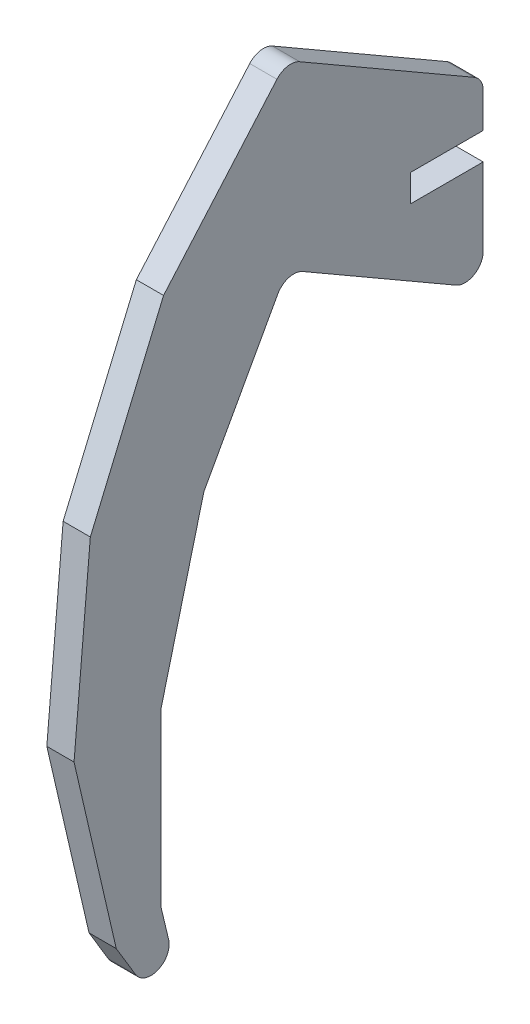
from build123d import *

# Parameters (mm, degrees)
BOSS_EXTRUDE1_DEPTH = 3


with BuildPart() as part:
    # Sketch1 → Boss-Extrude1 (new body)
    with BuildSketch(Plane(origin=(0, 0, 0), x_dir=(0, 0, -1), z_dir=(1, 0, 0))):
        with BuildLine():
            Line((-13.869045208, -53.846884879), (-13.019160894, -57.395119241))
            ThreePointArc((-13.019160894, -57.395119241), (-14.207117004, -59.712178989), (-16.67823792, -58.891467706))
            Line((-16.67823792, -58.891467706), (-18.79288086, -55.373986049))
            Line((-18.79288086, -55.373986049), (-23.446176246, -35.239966644))
            Line((-23.446176246, -35.239966644), (-21.649968985, -14.653428937))
            Line((-21.649968985, -14.653428937), (-13.580084357, 4.370473329))
            Line((-13.580084357, 4.370473329), (-1.081593074, 18.755177998))
            ThreePointArc((-1.081593074, 18.755177998), (0.097807511, 19.415947524), (1.428134813, 19.175465981))
            Line((1.428134813, 19.175465981), (20.650635095, 8.077350269))
            ThreePointArc((20.650635095, 8.077350269), (21.382685902, 7.345299462), (21.650635095, 6.345299462))
            Line((21.650635095, 6.345299462), (21.650635095, 2.5))
            Line((21.650635095, 2.5), (13.650635095, 2.5))
            Line((13.650635095, 2.5), (13.650635095, -0.5))
            Line((13.650635095, -0.5), (21.650635095, -0.5))
            Line((21.650635095, -0.5), (21.650635095, -9.035898385))
            ThreePointArc((21.650635095, -9.035898385), (20.650635095, -10.767949192), (18.650635095, -10.767949192))
            Line((18.650635095, -10.767949192), (1.767371596, -1.020392466))
            ThreePointArc((1.767371596, -1.020392466), (0.230262068, -0.825914438), (-0.984510925, -1.787607726))
            Line((-0.984510925, -1.787607726), (-9.132781883, -16.582681858))
            Line((-9.132781883, -16.582681858), (-13.854695348, -34.915618767))
            Line((-13.854695348, -34.915618767), (-13.869045208, -53.846884879))
        make_face()
    extrude(amount=BOSS_EXTRUDE1_DEPTH)


solid = part.part
